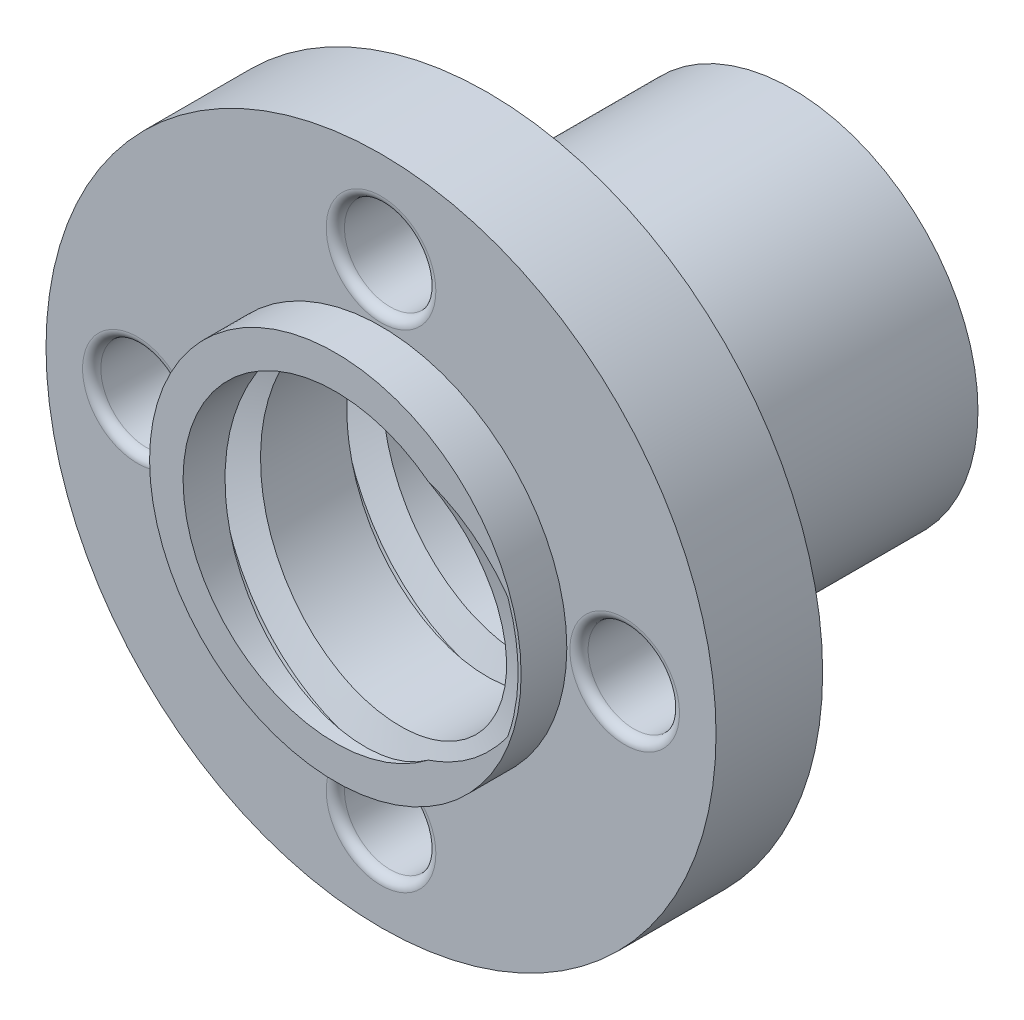
from build123d import *

# Parameters (mm, degrees)
SKETCH1_R                = 11
SKETCH1_R_2              = 5.1
SKETCH1_R_3              = 1.5
BOSS_EXTRUDE1_DEPTH      = 3.5
BOSS_EXTRUDE2_DEPTH      = 1.5
BOSS_EXTRUDE2_DEPTH_BACK = 13.5
SKETCH2_R                = 6.1
SKETCH2_R_2              = 5
CUT_SWEEP1_PITCH         = 4
FILLET2_R                = 0.3


with BuildPart() as part:
    # Sketch1 → Boss-Extrude1 (new body)
    with BuildSketch(Plane.XY):
        Circle(SKETCH1_R)
        Circle(SKETCH1_R_2, mode=Mode.SUBTRACT)
        with Locations((0, 8)):
            Circle(SKETCH1_R_3, mode=Mode.SUBTRACT)
        with Locations((8, 0)):
            Circle(SKETCH1_R_3, mode=Mode.SUBTRACT)
        with Locations((0, -8)):
            Circle(SKETCH1_R_3, mode=Mode.SUBTRACT)
        with Locations((-8, 0)):
            Circle(SKETCH1_R_3, mode=Mode.SUBTRACT)
    extrude(amount=-BOSS_EXTRUDE1_DEPTH)

    # Sketch2 → Boss-Extrude2 (add, two sides: drawn at the far end of the back side and taken through both)
    with BuildSketch(Plane.XY.offset(-BOSS_EXTRUDE2_DEPTH_BACK)):
        Circle(SKETCH2_R)
        Circle(SKETCH2_R_2, mode=Mode.SUBTRACT)
    extrude(amount=BOSS_EXTRUDE2_DEPTH + BOSS_EXTRUDE2_DEPTH_BACK)

    # Cut-Sweep1: arcs per turn and ends read off the stored shape
    # Cut-Sweep1: the profile of Sketch4 screwed along a right-hand helix through 5.5 turns, 12 arcs to a turn; built about Z, then put on its axis
    cut_sweep1_z = Axis((0, 0, 0), (0, 0, 1))
    cut_sweep1_corners = [(4, 0, -3.05), (4, 0, -4.95), (6, 0, -4.214588815), (6, 0, -3.785411185)]
    with BuildLine(mode=Mode.PRIVATE) as cut_sweep1_profile:
        Line(cut_sweep1_corners[0], cut_sweep1_corners[1])
        Line(cut_sweep1_corners[1], cut_sweep1_corners[2])
        Line(cut_sweep1_corners[2], cut_sweep1_corners[3])
        Line(cut_sweep1_corners[3], cut_sweep1_corners[0])
    cut_sweep1_cap = Face(cut_sweep1_profile.wire())
    cut_sweep1_turn_angles = [0, 15, 30, 45, 60, 75, 90, 105, 120, 135, 150, 165, 180, 195, 210, 225, 240, 255, 270, 285, 300, 315, 330, 345, 360]
    cut_sweep1_turn_weights = [1, 0.9659258262890683, 1, 0.9659258262890683, 1, 0.9659258262890683, 1, 0.9659258262890683, 1, 0.9659258262890683, 1, 0.9659258262890683, 1, 0.9659258262890683, 1, 0.9659258262890683, 1, 0.9659258262890683, 1, 0.9659258262890683, 1, 0.9659258262890683, 1, 0.9659258262890683, 1]
    cut_sweep1_turn_rails = [Edge.make_bspline([Vector(p[0], p[1], 0).rotate(cut_sweep1_z, cut_sweep1_turn_angles[k]) / cut_sweep1_turn_weights[k] + Vector(0, 0, p[2] + CUT_SWEEP1_PITCH * cut_sweep1_turn_angles[k] / 360) for k in range(25)], [0, 0, 0, 1, 1, 2, 2, 3, 3, 4, 4, 5, 5, 6, 6, 7, 7, 8, 8, 9, 9, 10, 10, 11, 11, 12, 12, 12], 2, cut_sweep1_turn_weights) for p in cut_sweep1_corners]
    cut_sweep1_turn_sides = [Face.make_surface_from_curves(cut_sweep1_turn_rails[p[0]], cut_sweep1_turn_rails[p[1]]) for p in [(0, 1), (1, 2), (2, 3), (3, 0)]]
    cut_sweep1_last_angles = [1800, 1815, 1830, 1845, 1860, 1875, 1890, 1905, 1920, 1935, 1950, 1965, 1980]
    cut_sweep1_last_weights = [1, 0.9659258262890683, 1, 0.9659258262890683, 1, 0.9659258262890683, 1, 0.9659258262890683, 1, 0.9659258262890683, 1, 0.9659258262890683, 1]
    cut_sweep1_last_rails = [Edge.make_bspline([Vector(p[0], p[1], 0).rotate(cut_sweep1_z, cut_sweep1_last_angles[k]) / cut_sweep1_last_weights[k] + Vector(0, 0, p[2] + CUT_SWEEP1_PITCH * cut_sweep1_last_angles[k] / 360) for k in range(13)], [0, 0, 0, 1, 1, 2, 2, 3, 3, 4, 4, 5, 5, 6, 6, 6], 2, cut_sweep1_last_weights) for p in cut_sweep1_corners]
    cut_sweep1_last_sides = [Face.make_surface_from_curves(cut_sweep1_last_rails[p[0]], cut_sweep1_last_rails[p[1]]) for p in [(0, 1), (1, 2), (2, 3), (3, 0)]]
    cut_sweep1 = Plane(origin=(0, 0, 1.5), x_dir=(1, 0, 0), z_dir=(0, 0, -1)) * Solid(Shell([*[p.moved(Location((0, 0, CUT_SWEEP1_PITCH * i))) for i in range(5) for p in cut_sweep1_turn_sides], *cut_sweep1_last_sides, cut_sweep1_cap, cut_sweep1_cap.rotate(cut_sweep1_z, 1980).moved(Location((0, 0, CUT_SWEEP1_PITCH * 1980 / 360)))]))
    add(cut_sweep1, mode=Mode.SUBTRACT)

    # Fillet2
    fillet2_edges = [part.edges().sort_by_distance(p)[0] for p in [
        (6.5, 0, 0),
        (-1.5, -8, 0),
        (-9.5, 0, 0),
        (-1.5, 8, 0),
    ]]
    fillet(fillet2_edges, radius=FILLET2_R)


solid = part.part
